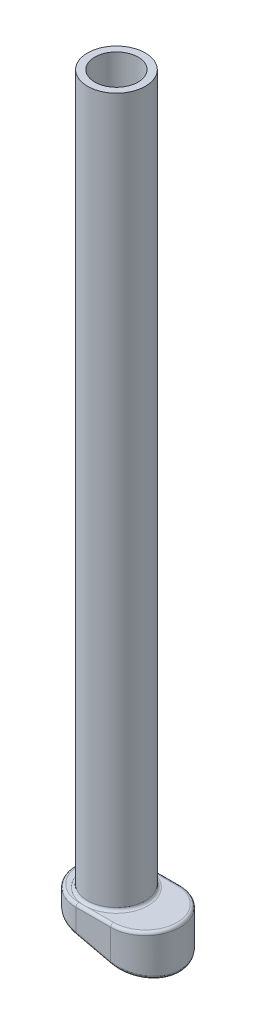
from build123d import *

# Parameters (mm, degrees)
SKETCH_1_R               = 10
SKETCH_1_R_2             = 7.5
EXTRUDE_1_DEPTH          = 250
EXTRUDE_2_DEPTH          = 5
EXTRUDE_2_DEPTH_BACK     = 10
CUT_EXTRUDE_1_DEPTH      = 252.25286068
CUT_EXTRUDE_1_DEPTH_BACK = 252.25286068
FILLET_1_R               = 1
SKETCH_5_R               = 4
SKETCH_5_R_2             = 2
CUT_EXTRUDE_2_DEPTH      = 5


with BuildPart() as part:
    # 草图1 → 凸台-拉伸1 (new body)
    with BuildSketch(Plane(origin=(0, 0, 0), x_dir=(1, 0, 0), z_dir=(0, 1, 0))):
        with Locations(Location((0, 0, 0), (0, 0, 270))):
            Circle(SKETCH_1_R)
        with Locations(Location((0, 0, 0), (0, 0, 270))):
            Circle(SKETCH_1_R_2, mode=Mode.SUBTRACT)
    extrude(amount=EXTRUDE_1_DEPTH)

    # 草图2 → 凸台-拉伸2 (add, two sides: drawn at the far end of the back side and taken through both)
    with BuildSketch(Plane(origin=(0, 0, 0), x_dir=(1, 0, 0), z_dir=(0, 1, 0)).offset(-EXTRUDE_2_DEPTH_BACK)):
        with BuildLine():
            Line((10, -12), (-2, -12))
            ThreePointArc((-2, -12), (-14, 0), (-2, 12))
            Line((-2, 12), (10, 12))
            ThreePointArc((10, 12), (22, 0), (10, -12))
        make_face()
    extrude(amount=EXTRUDE_2_DEPTH + EXTRUDE_2_DEPTH_BACK)

    # 草图4 → 切除-拉伸1 (cut, two sides: drawn at the far end of the back side and taken through both)
    with BuildSketch(Plane.XY.offset(-CUT_EXTRUDE_1_DEPTH_BACK)):
        Polygon((-14, -1.688745119), (-14, -10), (22, -10), align=None)
    extrude(amount=CUT_EXTRUDE_1_DEPTH + CUT_EXTRUDE_1_DEPTH_BACK, mode=Mode.SUBTRACT)

    # 圆角1
    fillet_1_edges = [part.edges().sort_by_distance(p)[0] for p in [
        (0, 5, -10),
        (22, 5, 0),
        (4, 5, -12),
        (-14, 5, 0),
        (4, 5, 12),
        (18.485281374, -9.188563269, -8.485281374),
        (-10.485281374, -2.500181851, 8.485281374),
        (4, -5.84437256, 12),
        (4, -5.84437256, -12),
    ]]
    fillet(fillet_1_edges, radius=FILLET_1_R - 0.0001)  # a hair under: the kernel refuses the full size

    # 草图5 → 切除-拉伸2 (cut)
    with BuildSketch(Plane(origin=(-1.078590243, -4.671887617, 0), x_dir=(0.9743700647852368, -0.22495105434385856, 0), z_dir=(-0.22495105434385856, -0.9743700647852368, 0))):
        with Locations((-5, 0)):
            Circle(SKETCH_5_R)
        with Locations((5.392304845, 6)):
            Circle(SKETCH_5_R_2)
        with Locations((5.392304845, -6)):
            Circle(SKETCH_5_R_2)
    extrude(amount=-CUT_EXTRUDE_2_DEPTH, mode=Mode.SUBTRACT)


solid = part.part
